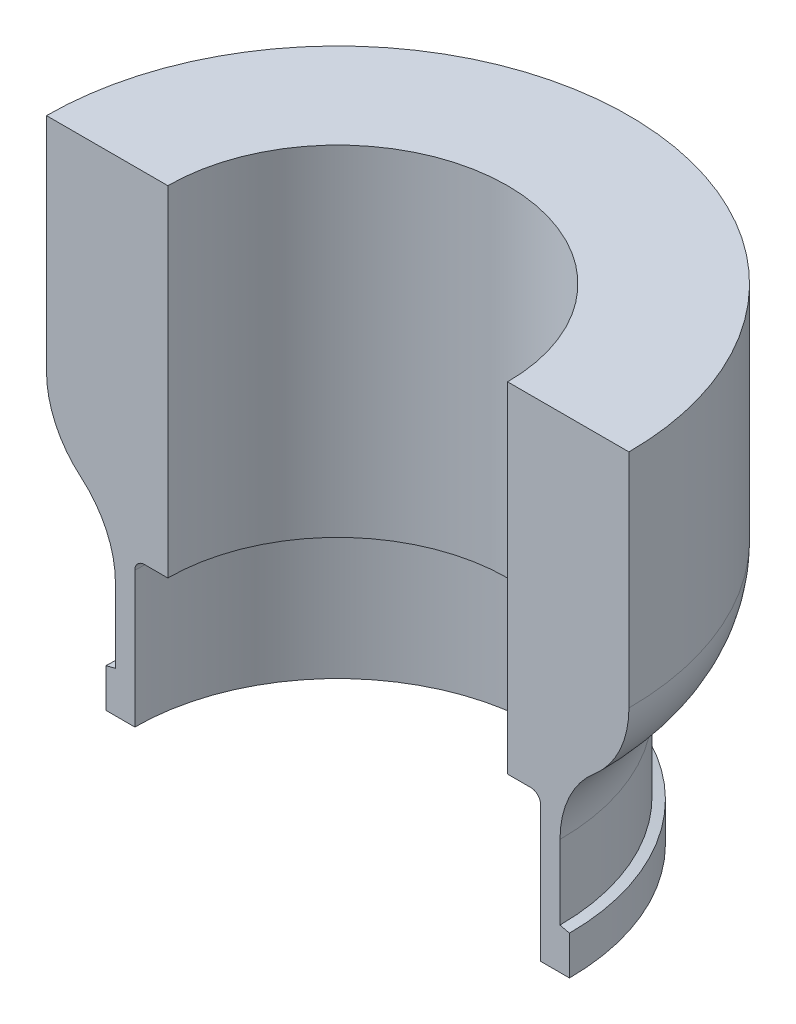
from build123d import *

# Parameters (mm, degrees)
CUT_EXTRUDE3_DEPTH           = 25
CUT_EXTRUDE3_DEPTH_BACK      = 40
CUT_EXTRUDE5_START           = -5
CUT_EXTRUDE5_DEPTH           = 5
BOSS_EXTRUDE2_DEPTH          = 5
SKETCH14_R                   = 1
BOSS_EXTRUDE3_DEPTH          = 3
BOSS_EXTRUDE4_START          = 3
SKETCH15_R                   = 1
BOSS_EXTRUDE4_DEPTH          = 3
CUT_EXTRUDE6_DEPTH           = 22
SKETCH17_W                   = 7
SKETCH17_H                   = 20.303986046
CUT_REVOLVE1_ANGLE           = 45
CUT_REVOLVE1_OTHER_WAY_ANGLE = 45
INTERSECT1_OUTLINE_W         = 62
INTERSECT1_OUTLINE_H         = 54
INTERSECT1_DEPTH             = 31
INTERSECT1_START             = -5
INTERSECT1_2_OUTLINE_W       = 12
INTERSECT1_2_OUTLINE_H       = 4
INTERSECT1_2_DEPTH           = 5


with BuildPart() as part:
    # Sketch1 → Revolve1 (revolve)
    with BuildSketch(Plane.XY, mode=Mode.PRIVATE) as revolve1_sk:
        with BuildLine():
            Line((20.9, 0), (23.871591838, 0))
            Line((23.871591838, 0), (23.871591838, 4))
            Line((23.871591838, 4), (22.9, 4.236662843))
            Line((22.9, 4.236662843), (22.9, 11.874576818))
            ThreePointArc((22.9, 11.874576818), (23.83692213, 16.100759435), (26.472123903, 19.535021249))
            Line((26.472123903, 19.535021249), (26.427876097, 19.497892931))
            ThreePointArc((26.427876097, 19.497892931), (29.06307787, 22.932154745), (30, 27.158337362))
            Line((30, 27.158337362), (30, 50))
            ThreePointArc((30, 50), (28.828427125, 52.828427125), (26, 54))
            Line((26, 54), (0, 54))
            Line((0, 54), (0, 15))
            Line((0, 15), (19.9, 15))
            ThreePointArc((19.9, 15), (20.607106781, 14.707106781), (20.9, 14))
            Line((20.9, 14), (20.9, 0))
        make_face()
    revolve(revolve1_sk.sketch.rotate(Axis((0, 0, 0), (0, 1, 0)), 90), axis=Axis((0, 0, 0), (0, 1, 0)))

    # Sketch11 → Cut-Extrude3 (cut, two sides: drawn at the far end of the back side and taken through both)
    with BuildSketch(Plane(origin=(0, 19.535021249, 0), x_dir=(-1, 0, 0), z_dir=(0, -1, 0)).offset(-CUT_EXTRUDE3_DEPTH_BACK)):
        with BuildLine():
            Line((-17.5, 0), (17.5, 0))
            ThreePointArc((17.5, 0), (0, 17.5), (-17.5, 0))
        make_face()
    extrude(amount=CUT_EXTRUDE3_DEPTH + CUT_EXTRUDE3_DEPTH_BACK, mode=Mode.SUBTRACT)

    # Sketch9 → Cut-Extrude5 (cut)
    with BuildSketch(Plane(origin=(0, 50, 0), x_dir=(-1, 0, 0), z_dir=(0, -1, 0)).offset(CUT_EXTRUDE5_START)):
        with BuildLine():
            Line((-30, 0), (30, 0))
            ThreePointArc((30, 0), (0, 30), (-30, 0))
        make_face()
    extrude(amount=CUT_EXTRUDE5_DEPTH, mode=Mode.SUBTRACT)

    # Sketch13 → Boss-Extrude2 (add)
    with BuildSketch(Plane(origin=(0, 0, 0), x_dir=(-1, 0, 0), z_dir=(0, 0, -1))):
        with BuildLine():
            Line((22.5, 53.5), (26.5, 53.5))
            ThreePointArc((26.5, 53.5), (26.853553391, 53.353553391), (27, 53))
            Line((27, 53), (27, 51))
            ThreePointArc((27, 51), (26.853553391, 50.646446609), (26.5, 50.5))
            Line((26.5, 50.5), (22.5, 50.5))
            ThreePointArc((22.5, 50.5), (22.146446609, 50.646446609), (22, 51))
            Line((22, 51), (22, 53))
            ThreePointArc((22, 53), (22.146446609, 53.353553391), (22.5, 53.5))
        make_face()
        with BuildLine():
            Line((-26.5, 53.5), (-22.5, 53.5))
            ThreePointArc((-22.5, 53.5), (-22.146446609, 53.353553391), (-22, 53))
            Line((-22, 53), (-22, 51))
            ThreePointArc((-22, 51), (-22.146446609, 50.646446609), (-22.5, 50.5))
            Line((-22.5, 50.5), (-26.5, 50.5))
            ThreePointArc((-26.5, 50.5), (-26.853553391, 50.646446609), (-27, 51))
            Line((-27, 51), (-27, 53))
            ThreePointArc((-27, 53), (-26.853553391, 53.353553391), (-26.5, 53.5))
        make_face()
    extrude(amount=BOSS_EXTRUDE2_DEPTH)

    # Sketch14 → Boss-Extrude3 (add)
    with BuildSketch(Plane.ZY.offset(-22)):
        with Locations(Location((-3, 52, 0), (0, 0, 270))):
            Circle(SKETCH14_R)
    extrude(amount=BOSS_EXTRUDE3_DEPTH)

    # Sketch15 → Boss-Extrude4 (add)
    with BuildSketch(Plane(origin=(-22, 0, 0), x_dir=(0, 0, -1), z_dir=(1, 0, 0)).offset(BOSS_EXTRUDE4_START)):
        with Locations(Location((3, 52, 0), (0, 0, 270))):
            Circle(SKETCH15_R)
    extrude(amount=-BOSS_EXTRUDE4_DEPTH)

    # Sketch16 → Cut-Extrude6 (cut)
    with BuildSketch(Plane(origin=(0, 50, 0), x_dir=(-1, 0, 0), z_dir=(0, -1, 0))):
        with BuildLine():
            Line((25.690465157, -4), (-25.690465157, -4))
            ThreePointArc((-25.690465157, -4), (0, -26), (25.690465157, -4))
        make_face()
    extrude(amount=CUT_EXTRUDE6_DEPTH, mode=Mode.SUBTRACT)

    # Sketch17 → Cut-Revolve1 (revolve, cut)
    with BuildSketch(Plane(origin=(0, 0, 0), x_dir=(0, 0, -1), z_dir=(1, 0, 0))):
        with Locations((-28.883918314, 38.580330385)):
            Rectangle(SKETCH17_W, SKETCH17_H)
    revolve(axis=Axis((0, 0, 0), (0, 0.9999633813881498, 0.008557796607647805)), revolution_arc=CUT_REVOLVE1_ANGLE, mode=Mode.SUBTRACT)

    # Sketch17 → Cut-Revolve1 other way (revolve, cut)
    with BuildSketch(Plane(origin=(0, 0, 0), x_dir=(0, 0, -1), z_dir=(1, 0, 0))):
        with Locations((-28.883918314, 38.580330385)):
            Rectangle(SKETCH17_W, SKETCH17_H)
    revolve(axis=Axis((0, 0, 0), (0, -0.9999633813881498, -0.008557796607647805)), revolution_arc=CUT_REVOLVE1_OTHER_WAY_ANGLE, mode=Mode.SUBTRACT)

    # Intersect1: read off the stored shape, not the designer's step
    # Intersect1 outline → Intersect1 (cut)
    with BuildSketch(Plane.XY):
        with Locations((0, 27)):
            Rectangle(INTERSECT1_OUTLINE_W, INTERSECT1_OUTLINE_H)
    extrude(amount=INTERSECT1_DEPTH, mode=Mode.SUBTRACT)

    # Intersect1 2 outline → Intersect1 2 (cut)
    with BuildSketch(Plane.XY.offset(INTERSECT1_START)):
        with Locations((-25, 52)):
            Rectangle(INTERSECT1_2_OUTLINE_W, INTERSECT1_2_OUTLINE_H)
        with Locations((25, 52)):
            Rectangle(INTERSECT1_2_OUTLINE_W, INTERSECT1_2_OUTLINE_H)
    extrude(amount=INTERSECT1_2_DEPTH, mode=Mode.SUBTRACT)


solid = part.part
